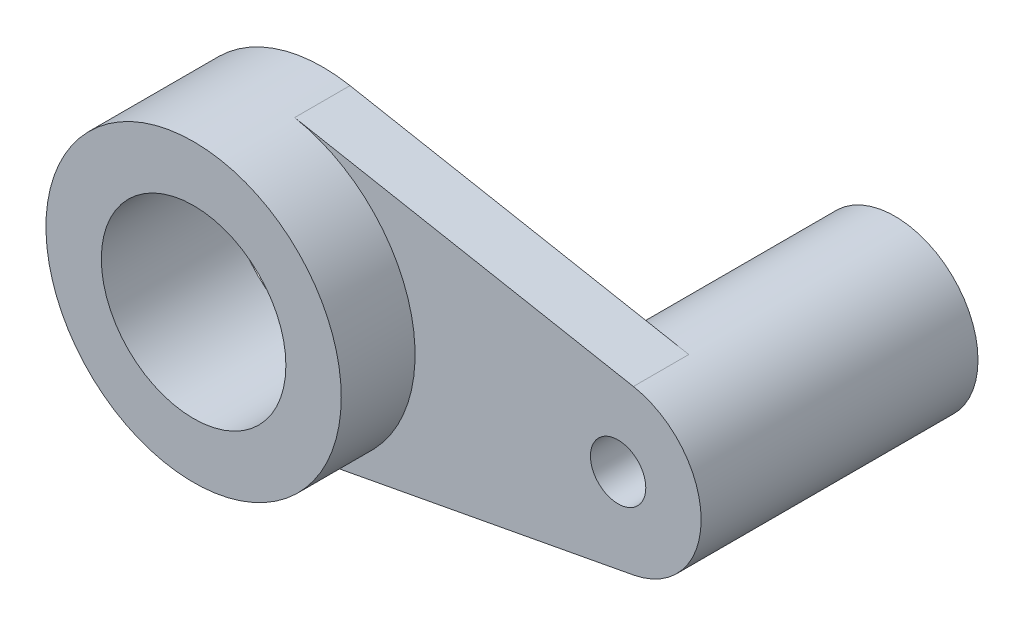
from build123d import *

# Parameters (mm, degrees)
CROQUIS1_R              = 10
SALIENTE_EXTRUIR2_DEPTH = 14
CROQUIS1_6_R            = 3
SALIENTE_EXTRUIR3_DEPTH = 6
SALIENTE_EXTRUIR4_START = -24
CROQUIS1_7_R            = 3
SALIENTE_EXTRUIR4_DEPTH = 24


with BuildPart() as part:
    # Croquis1 → Saliente-Extruir2 (new body)
    with BuildSketch(Plane.XY):
        with BuildLine():
            ThreePointArc((16, 0), (12.311740225, 10.218661979), (2.947368421, 15.726188966))
            ThreePointArc((2.947368421, 15.726188966), (-16, 0), (2.947368421, -15.726188966))
            ThreePointArc((2.947368421, -15.726188966), (12.311740225, -10.218661979), (16, 0))
        make_face()
        Circle(CROQUIS1_R, mode=Mode.SUBTRACT)
    extrude(amount=SALIENTE_EXTRUIR2_DEPTH)

    # Croquis1<6> → Saliente-Extruir3 (add)
    with BuildSketch(Plane.XY):
        with BuildLine():
            Line((39.657894737, 8.845981293), (2.947368421, 15.726188966))
            ThreePointArc((2.947368421, 15.726188966), (16, 0), (2.947368421, -15.726188966))
            Line((2.947368421, -15.726188966), (39.657894737, -8.845981293))
            ThreePointArc((39.657894737, -8.845981293), (47, 0), (39.657894737, 8.845981293))
        make_face()
        with Locations((38, 0)):
            Circle(CROQUIS1_6_R, mode=Mode.SUBTRACT)
    extrude(amount=SALIENTE_EXTRUIR3_DEPTH)

    # Croquis1<7> → Saliente-Extruir4 (add)
    with BuildSketch(Plane.XY.offset(SALIENTE_EXTRUIR4_START)):
        with BuildLine():
            ThreePointArc((47, 0), (44.925353877, 5.747997363), (39.657894737, 8.845981293))
            ThreePointArc((39.657894737, 8.845981293), (29, 0), (39.657894737, -8.845981293))
            ThreePointArc((39.657894737, -8.845981293), (44.925353877, -5.747997363), (47, 0))
        make_face()
        with Locations((38, 0)):
            Circle(CROQUIS1_7_R, mode=Mode.SUBTRACT)
    extrude(amount=SALIENTE_EXTRUIR4_DEPTH)


solid = part.part
